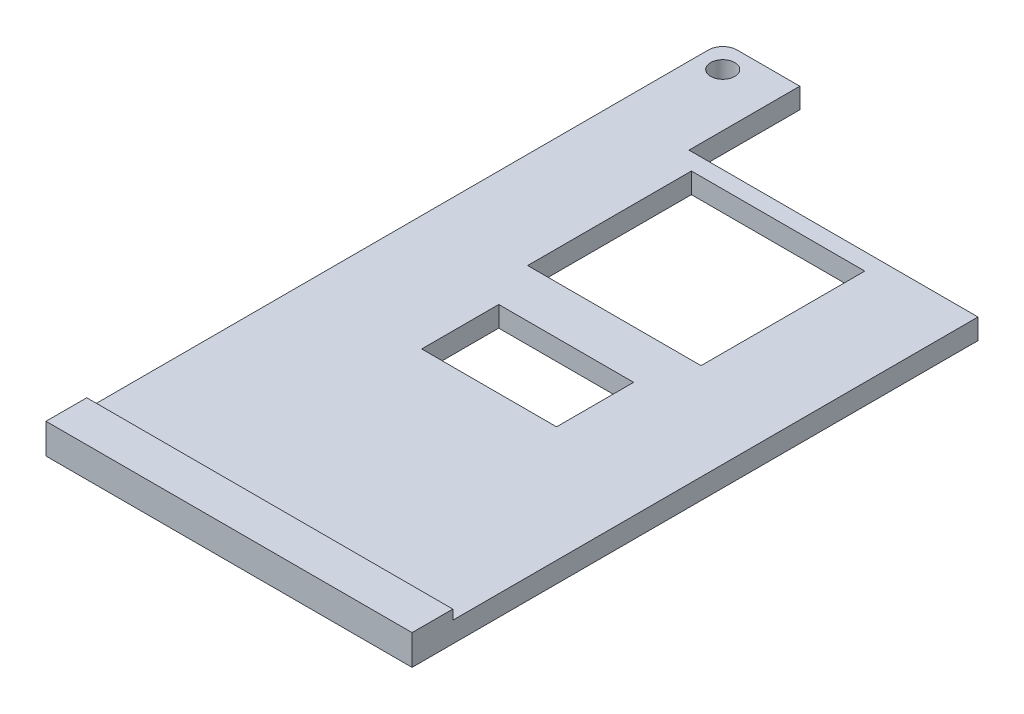
from build123d import *

# Parameters (mm, degrees)
BOSS_EXTRUDE1_OUTLINE_W   = 14
BOSS_EXTRUDE1_OUTLINE_H   = 8
BOSS_EXTRUDE1_OUTLINE_R   = 1.25
BOSS_EXTRUDE1_OUTLINE_W_2 = 18
BOSS_EXTRUDE1_OUTLINE_H_2 = 17
BOSS_EXTRUDE1_DEPTH       = 2.13
SKETCH2_W                 = 38
SKETCH2_H                 = 4.23
BOSS_EXTRUDE2_DEPTH       = 1
SKETCH3_W                 = 8
SKETCH3_H                 = 2.13
CUT_EXTRUDE1_DEPTH        = 11.5


# Read off the part's stored shape, not the designer's step: Boss-Extrude1
with BuildPart() as part:
    # Boss-Extrude1 outline → Boss-Extrude1 (new body)
    with BuildSketch(Plane(origin=(0, 0, 0), x_dir=(1, 0, 0), z_dir=(0, 1, 0))):
        with BuildLine():
            ThreePointArc((38, 88), (37.560660172, 89.060660172), (36.5, 89.5))
            Line((36.5, 89.5), (30, 89.5))
            Line((30, 89.5), (30, 78))
            Line((30, 78), (8, 78))
            Line((8, 78), (8, 89.5))
            Line((8, 89.5), (1.5, 89.5))
            ThreePointArc((1.5, 89.5), (0.439339828, 89.060660172), (0, 88))
            Line((0, 88), (0, 19.25))
            Line((0, 19.25), (38, 19.25))
            Line((38, 19.25), (38, 88))
        make_face()
        with Locations((19, 50.25)):
            Rectangle(BOSS_EXTRUDE1_OUTLINE_W, BOSS_EXTRUDE1_OUTLINE_H, mode=Mode.SUBTRACT)
        with Locations((2.5, 87)):
            Circle(BOSS_EXTRUDE1_OUTLINE_R, mode=Mode.SUBTRACT)
        with Locations((19, 67.75)):
            Rectangle(BOSS_EXTRUDE1_OUTLINE_W_2, BOSS_EXTRUDE1_OUTLINE_H_2, mode=Mode.SUBTRACT)
        with Locations((35.5, 87)):
            Circle(BOSS_EXTRUDE1_OUTLINE_R, mode=Mode.SUBTRACT)
    extrude(amount=BOSS_EXTRUDE1_DEPTH)

    # Sketch2 → Boss-Extrude2 (add)
    with BuildSketch(Plane(origin=(0, 2.13, 0), x_dir=(1, 0, 0), z_dir=(0, 1, 0))):
        with Locations((19, 21.365)):
            Rectangle(SKETCH2_W, SKETCH2_H)
    extrude(amount=BOSS_EXTRUDE2_DEPTH)

    # Sketch3 → Cut-Extrude1 (cut)
    with BuildSketch(Plane(origin=(0, 0, -89.5), x_dir=(-1, 0, 0), z_dir=(0, 0, -1))):
        with Locations((-34, 1.065)):
            Rectangle(SKETCH3_W, SKETCH3_H)
    extrude(amount=-CUT_EXTRUDE1_DEPTH, mode=Mode.SUBTRACT)


solid = part.part
